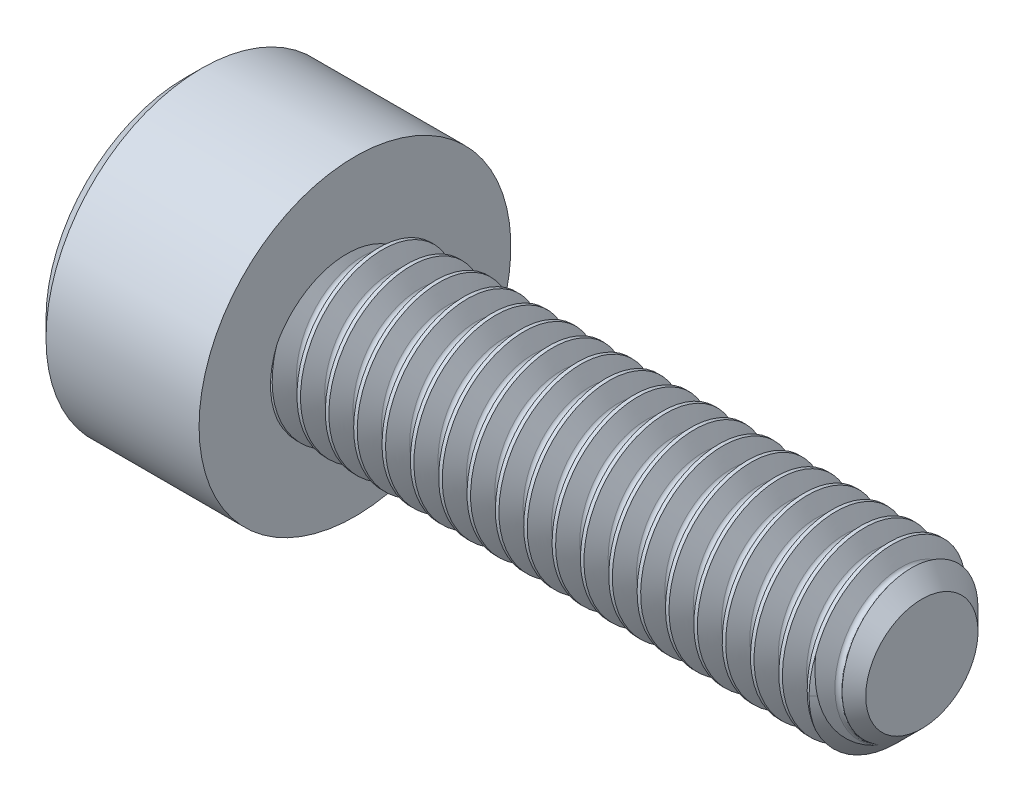
from build123d import *

# Parameters (mm, degrees)
CHAMFER1_SIZE      = 0.5
CHAMFER2_SIZE      = 0.3
CUT_EXTRUDE1_DEPTH = 2.5
CHAMFER3_SIZE      = 0.3
CUT_SWEEP1_PITCH   = 0.5
CUT_SWEEP1_TO      = 10


with BuildPart() as part:
    # Sketch1 → Revolve1 (revolve)
    with BuildSketch(Plane.XY, mode=Mode.PRIVATE) as revolve1_sk:
        Polygon((0, 0), (0, 2.75), (3, 2.75), (3, 1.49), (13, 1.49), (13, 0), align=None)
    revolve(revolve1_sk.sketch.rotate(Axis((-88.705490849, 0, 0), (1, 0, 0)), 90), axis=Axis((-88.705490849, 0, 0), (1, 0, 0)))

    # Chamfer1
    chamfer1_edges = [part.edges().sort_by_distance(p)[0] for p in [
        (13, 0, -1.49),
    ]]
    chamfer(chamfer1_edges, length=CHAMFER1_SIZE)

    # Chamfer2
    chamfer2_edges = [part.edges().sort_by_distance(p)[0] for p in [
        (0, 0, -2.75),
    ]]
    chamfer(chamfer2_edges, length=CHAMFER2_SIZE)

    # Sketch3 → Cut-Extrude1 (cut)
    with BuildSketch(Plane(origin=(0, 0, 0), x_dir=(0, 0, -1), z_dir=(1, 0, 0))):
        Polygon((-1.443375673, 0), (-0.721687836, -1.25), (0.721687836, -1.25), (1.443375673, 0), (0.721687836, 1.25), (-0.721687836, 1.25), align=None)
    extrude(amount=CUT_EXTRUDE1_DEPTH, mode=Mode.SUBTRACT)

    # Chamfer3
    chamfer3_edges = [part.edges().sort_by_distance(p)[0] for p in [
        (0, 0.625, 1.082531755),
        (0, -0.625, 1.082531755),
        (0, -1.25, 0),
        (0, -0.625, -1.082531755),
        (0, 0.625, -1.082531755),
        (0, 1.25, 0),
    ]]
    chamfer(chamfer3_edges, length=CHAMFER3_SIZE)

    # Cut-Sweep1: arcs per turn and ends read off the stored shape
    # Cut-Sweep1: the profile of Sketch8 screwed along a right-hand helix through 21 turns, 6 arcs to a turn; built about Z, then put on its axis
    cut_sweep1_z = Axis((0, 0, 0), (0, 0, 1))
    cut_sweep1_corners = [(1.219375, 0, -0.062498167), (1.6794375, 0, -0.328115375), (1.6794375, 0, 0.328115375), (1.219375, 0, 0.062498167), (1.183291667, 0, 0)]
    with BuildLine(mode=Mode.PRIVATE) as cut_sweep1_profile:
        Line(cut_sweep1_corners[0], cut_sweep1_corners[1])
        Line(cut_sweep1_corners[1], cut_sweep1_corners[2])
        Line(cut_sweep1_corners[2], cut_sweep1_corners[3])
        ThreePointArc((1.219375, 0, 0.062498167), (1.192960167, 0, 0.036083333), (1.183291667, 0, 0))
        ThreePointArc((1.183291667, 0, 0), (1.192960167, 0, -0.036083333), (1.219375, 0, -0.062498167))
    cut_sweep1_cap = Face(cut_sweep1_profile.wire())
    cut_sweep1_arcs = [((1.219375, 0, 0.062498167), (1.183291667, 0, 0.041665444), (1.183291667, 0, 0), (1, 0.86602540378444, 1)), ((1.183291667, 0, 0), (1.183291667, 0, -0.041665444), (1.219375, 0, -0.062498167), (1, 0.86602540378444, 1))]  # start, shoulder, end, weights
    cut_sweep1_turn_angles = [0, 30, 60, 90, 120, 150, 180, 210, 240, 270, 300, 330, 360]
    cut_sweep1_turn_weights = [1, 0.8660254037844387, 1, 0.8660254037844387, 1, 0.8660254037844387, 1, 0.8660254037844387, 1, 0.8660254037844387, 1, 0.8660254037844387, 1]
    cut_sweep1_turn_rails = [Edge.make_bspline([Vector(p[0], p[1], 0).rotate(cut_sweep1_z, cut_sweep1_turn_angles[k]) / cut_sweep1_turn_weights[k] + Vector(0, 0, p[2] + CUT_SWEEP1_PITCH * cut_sweep1_turn_angles[k] / 360) for k in range(13)], [0, 0, 0, 1, 1, 2, 2, 3, 3, 4, 4, 5, 5, 6, 6, 6], 2, cut_sweep1_turn_weights) for p in cut_sweep1_corners]
    cut_sweep1_turn_sides = [*[Face.make_surface_from_curves(cut_sweep1_turn_rails[p[0]], cut_sweep1_turn_rails[p[1]]) for p in [(0, 1), (1, 2), (2, 3)]], *[Face.make_bezier_surface([[Vector(p[j][0], p[j][1], 0).rotate(cut_sweep1_z, cut_sweep1_turn_angles[2 * i + k]) / cut_sweep1_turn_weights[2 * i + k] + Vector(0, 0, p[j][2] + CUT_SWEEP1_PITCH * cut_sweep1_turn_angles[2 * i + k] / 360) for k in range(3)] for j in range(3)], [[p[3][j] * cut_sweep1_turn_weights[2 * i + k] for k in range(3)] for j in range(3)]) for p in cut_sweep1_arcs for i in range(6)]]
    cut_sweep1_turn = Solid(Shell([*cut_sweep1_turn_sides, cut_sweep1_cap, cut_sweep1_cap.rotate(cut_sweep1_z, 360).moved(Location((0, 0, CUT_SWEEP1_PITCH * 360 / 360)))]))
    cut_sweep1_each = [*[cut_sweep1_turn.moved(Location((0, 0, CUT_SWEEP1_PITCH * i))) for i in range(21)]]
    add(Plane(origin=(13, 0, 0), x_dir=(0, 0, -1), z_dir=(-1, 0, 0)) * split(Compound([cut_sweep1_each[i] for i in range(0, 21, 2)]), bisect_by=Plane.XY.offset(CUT_SWEEP1_TO), keep=Keep.BOTTOM, mode=Mode.PRIVATE), mode=Mode.SUBTRACT)
    add(Plane(origin=(13, 0, 0), x_dir=(0, 0, -1), z_dir=(-1, 0, 0)) * split(Compound([cut_sweep1_each[i] for i in range(1, 21, 2)]), bisect_by=Plane.XY.offset(CUT_SWEEP1_TO), keep=Keep.BOTTOM, mode=Mode.PRIVATE), mode=Mode.SUBTRACT)


solid = part.part
